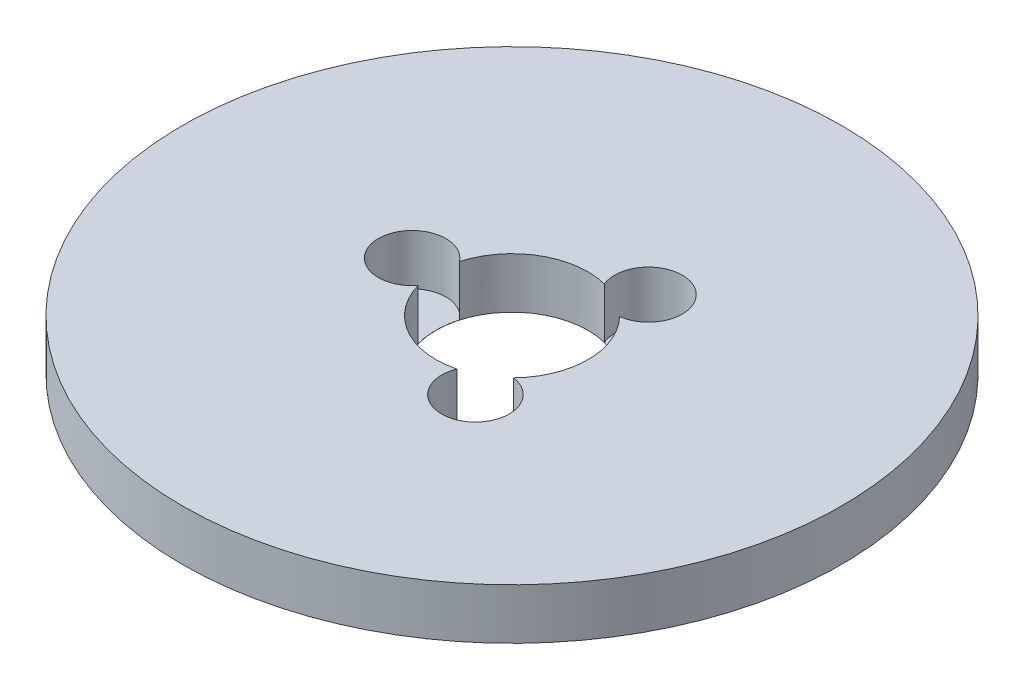
from build123d import *

# Parameters (mm, degrees)
SKETCH1_R           = 97.5
BOSS_EXTRUDE1_DEPTH = 15
SKETCH2_R           = 22.5
CUT_EXTRUDE1_DEPTH  = 139.699315067
SKETCH3_R           = 10
CUT_EXTRUDE2_DEPTH  = 14.960539219
CIRPATTERN1_COUNT   = 3


with BuildPart() as part:
    # Sketch1 → Boss-Extrude1 (new body)
    with BuildSketch(Plane(origin=(0, 0, 0), x_dir=(1, 0, 0), z_dir=(0, 1, 0))):
        Circle(SKETCH1_R)
    extrude(amount=BOSS_EXTRUDE1_DEPTH)

    # Sketch2 → Cut-Extrude1 (cut, through all)
    with BuildSketch(Plane(origin=(0, 0, 0), x_dir=(1, 0, 0), z_dir=(0, 1, 0))):
        Circle(SKETCH2_R)
    extrude(amount=CUT_EXTRUDE1_DEPTH, mode=Mode.SUBTRACT)

    # Sketch3 → Cut-Extrude2 (cut)
    with BuildSketch(Plane(origin=(0, 15, 0), x_dir=(1, 0, 0), z_dir=(0, 1, 0))):
        with Locations((-29.556108574, 0)):
            Circle(SKETCH3_R)
    cut_extrude2 = extrude(amount=-CUT_EXTRUDE2_DEPTH, mode=Mode.SUBTRACT)

    # CirPattern1: Cut-Extrude2 ×3 about axis
    cirpattern1_axis = Axis((0, 0, 0), (0, 1, 0))
    for i in range(1, CIRPATTERN1_COUNT):
        add(cut_extrude2.rotate(cirpattern1_axis, i * 360 / CIRPATTERN1_COUNT), mode=Mode.SUBTRACT)


solid = part.part
